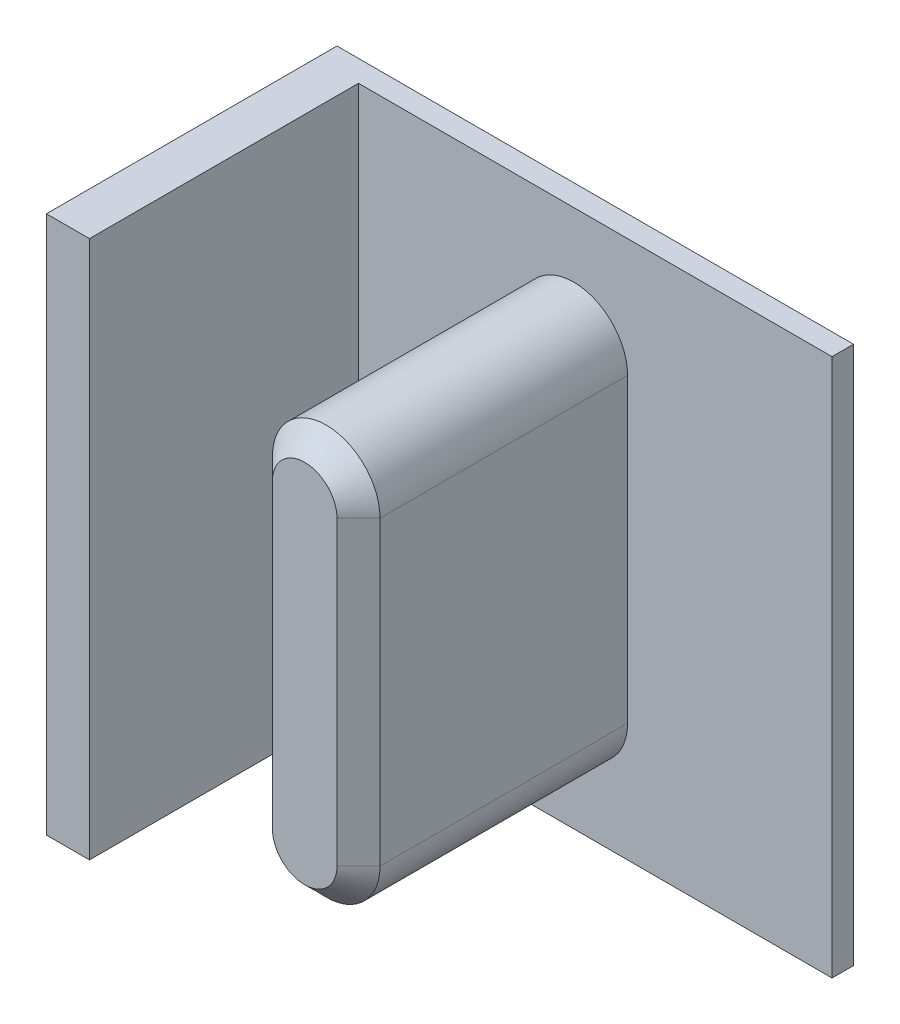
from build123d import *

# Parameters (mm, degrees)
SKETCH1_W           = 9.6
SKETCH1_H           = 10
BOSS_EXTRUDE1_DEPTH = 0.4
BOSS_EXTRUDE2_DEPTH = 5
SKETCH4_W           = 0.8
SKETCH4_H           = 10
BOSS_EXTRUDE3_DEPTH = 5
CHAMFER1_SIZE       = 0.4


with BuildPart() as part:
    # Sketch1 → Boss-Extrude1 (new body)
    with BuildSketch(Plane.XY):
        with Locations((4.8, 5)):
            Rectangle(SKETCH1_W, SKETCH1_H)
    extrude(amount=BOSS_EXTRUDE1_DEPTH)

    # Sketch3 → Boss-Extrude2 (add)
    with BuildSketch(Plane.XY.offset(0.4)):
        with BuildLine():
            Line((3.8, 2.2), (3.8, 7.8))
            ThreePointArc((3.8, 7.8), (4.8, 8.8), (5.8, 7.8))
            Line((5.8, 7.8), (5.8, 2.2))
            ThreePointArc((5.8, 2.2), (4.8, 1.2), (3.8, 2.2))
        make_face()
    extrude(amount=BOSS_EXTRUDE2_DEPTH)

    # Sketch4 → Boss-Extrude3 (add)
    with BuildSketch(Plane.XY.offset(0.4)):
        with Locations((0.4, 5)):
            Rectangle(SKETCH4_W, SKETCH4_H)
    extrude(amount=BOSS_EXTRUDE3_DEPTH)

    # Chamfer1
    chamfer1_edges = [part.edges().sort_by_distance(p)[0] for p in [
        (3.8, 5, 5.4),
        (4.8, 8.8, 5.4),
        (5.8, 5, 5.4),
        (4.8, 1.2, 5.4),
    ]]
    chamfer(chamfer1_edges, length=CHAMFER1_SIZE)


solid = part.part
